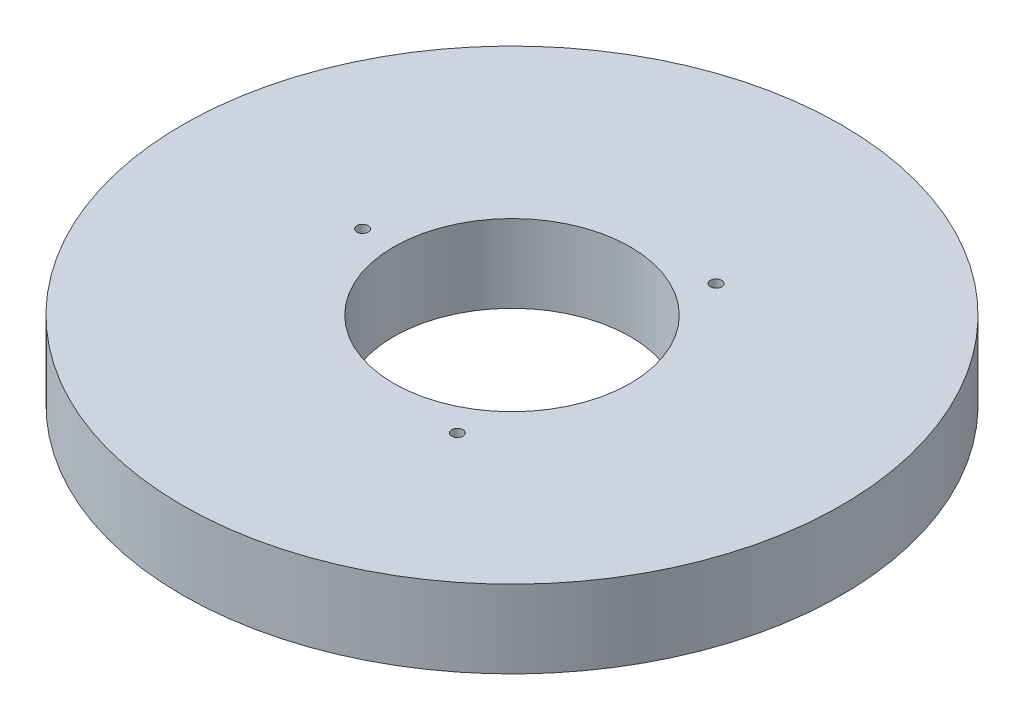
from build123d import *

# Parameters (mm, degrees)
SKETCH1_R           = 97.5
BOSS_EXTRUDE1_DEPTH = 23
SKETCH2_R           = 35
CUT_EXTRUDE1_DEPTH  = 140.790915299
SKETCH3_R           = 1.668376245
CUT_EXTRUDE2_DEPTH  = 21.971332098
CIRPATTERN1_COUNT   = 3


with BuildPart() as part:
    # Sketch1 → Boss-Extrude1 (new body)
    with BuildSketch(Plane(origin=(0, 0, 0), x_dir=(1, 0, 0), z_dir=(0, 1, 0))):
        Circle(SKETCH1_R)
    extrude(amount=BOSS_EXTRUDE1_DEPTH)

    # Sketch2 → Cut-Extrude1 (cut, through all)
    with BuildSketch(Plane(origin=(0, 0, 0), x_dir=(1, 0, 0), z_dir=(0, 1, 0))):
        Circle(SKETCH2_R)
    extrude(amount=CUT_EXTRUDE1_DEPTH, mode=Mode.SUBTRACT)

    # Sketch3 → Cut-Extrude2 (cut)
    with BuildSketch(Plane(origin=(0, 23, 0), x_dir=(1, 0, 0), z_dir=(0, 1, 0))):
        with Locations((-44.195851492, 0)):
            Circle(SKETCH3_R)
    cut_extrude2 = extrude(amount=-CUT_EXTRUDE2_DEPTH, mode=Mode.SUBTRACT)

    # CirPattern1: Cut-Extrude2 ×3 about axis
    cirpattern1_axis = Axis((0, 0, 0), (0, 1, 0))
    for i in range(1, CIRPATTERN1_COUNT):
        add(cut_extrude2.rotate(cirpattern1_axis, i * 360 / CIRPATTERN1_COUNT), mode=Mode.SUBTRACT)


solid = part.part
